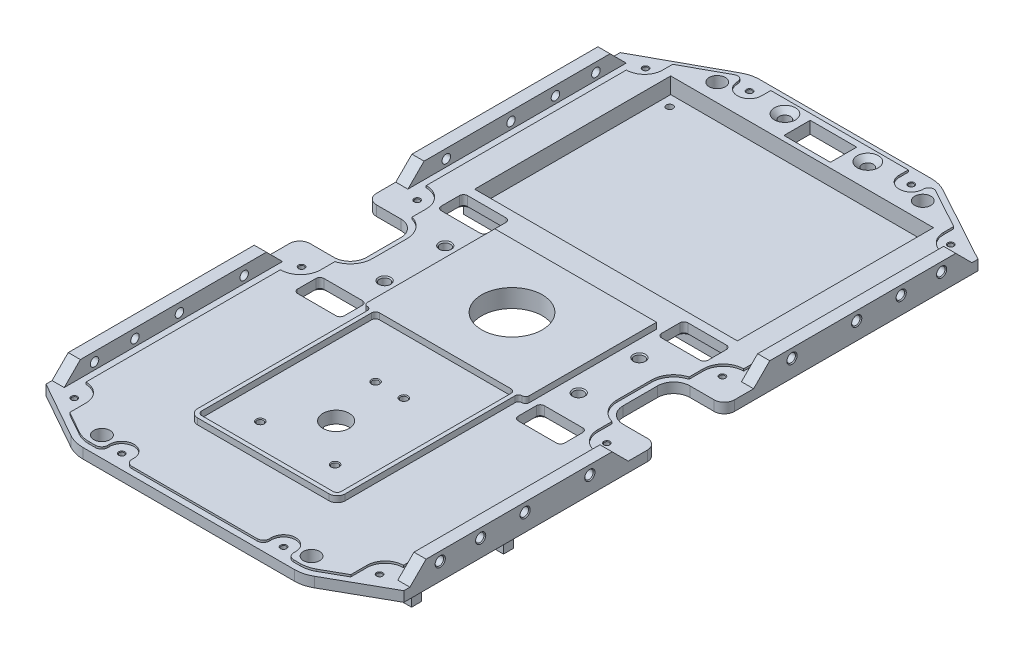
from build123d import *
from build123d.topology import SkipClean

# Parameters (mm, degrees)
BOSS_EXTRUDE1_START                                 = -5
BOSS_EXTRUDE1_OUTLINE_R                             = 6.5
BOSS_EXTRUDE1_OUTLINE_W                             = 23
BOSS_EXTRUDE1_OUTLINE_H                             = 13
BOSS_EXTRUDE1_DEPTH                                 = 5
BOSS_EXTRUDE5_OUTLINE_R                             = 6.5
BOSS_EXTRUDE5_OUTLINE_W                             = 23
BOSS_EXTRUDE5_OUTLINE_H                             = 13
BOSS_EXTRUDE5_DEPTH                                 = 1
BOSS_EXTRUDE7_START                                 = 1
BOSS_EXTRUDE7_DEPTH                                 = 3
BOSS_EXTRUDE6_START                                 = -6
SKETCH45_W                                          = 136
SKETCH45_H                                          = 102
SKETCH45_W_2                                        = 130
SKETCH45_H_2                                        = 97
BOSS_EXTRUDE6_DEPTH                                 = 5
SKETCH45_4_W                                        = 130
SKETCH45_4_H                                        = 97
CUT_EXTRUDE2_DEPTH                                  = 8
M4_TAPPED_HOLE2_D                                   = 3.3
M4_TAPPED_HOLE2_CSINK_D                             = 4.05
M4_TAPPED_HOLE2_CSINK_ANGLE                         = 90
SKETCH19_W                                          = 5
SKETCH19_H                                          = 5
BOSS_EXTRUDE4_DEPTH                                 = 87.5
BOSS_EXTRUDE2_DEPTH                                 = 6
CUT_EXTRUDE1_DEPTH                                  = 188.502666648
CUT_EXTRUDE1_DEPTH_BACK                             = 188.502666648
SKETCH20_R                                          = 6.5
MIRROR2_COPY_1_DEPTH                                = 6
M3_TAPPED_HOLE1_D                                   = 2.5
M3_TAPPED_HOLE1_CSINK_D                             = 3.05
M3_TAPPED_HOLE1_CSINK_ANGLE                         = 90
M4_TAPPED_HOLE1_D                                   = 3.3
M4_TAPPED_HOLE1_CSINK_D                             = 4.05
M4_TAPPED_HOLE1_CSINK_ANGLE                         = 90
M5_TAPPED_HOLE1_D                                   = 4.2
M5_TAPPED_HOLE1_DEPTH                               = 6
M5_TAPPED_HOLE1_CSINK_D                             = 5.05
M5_TAPPED_HOLE1_CSINK_ANGLE                         = 90
CSK_FOR_M5_COUNTERSUNK_FLAT_HEAD_SCREW1_D           = 5.5
CSK_FOR_M5_COUNTERSUNK_FLAT_HEAD_SCREW1_CSINK_D     = 10.4
CSK_FOR_M5_COUNTERSUNK_FLAT_HEAD_SCREW1_CSINK_ANGLE = 90
SKETCH60_R                                          = 4
CUT_EXTRUDE3_DEPTH                                  = 188.558657491
CUT_EXTRUDE4_DEPTH                                  = 188.686573841
CHAMFER1_SIZE                                       = 1.3
SKETCH66_R                                          = 15
CUT_EXTRUDE5_DEPTH                                  = 188.686573841


# Read off the part's stored shape, not the designer's step: Boss-Extrude1, Boss-Extrude5, Boss-Extrude7, M6 Tapped Hole1
with BuildPart() as part:
    # Boss-Extrude1 outline → Boss-Extrude1 (new body)
    with BuildSketch(Plane(origin=(0, 0, 0), x_dir=(1, 0, 0), z_dir=(0, 1, 0)).offset(BOSS_EXTRUDE1_START)):
        with BuildLine():
            Line((-52.308782665, -160), (52.308782665, -160))
            ThreePointArc((52.308782665, -160), (56.363203863, -159.477779839), (60.1529625, -157.945208594))
            Line((60.1529625, -157.945208594), (88.5, -142))
            Line((88.5, -142), (88.5, -21.5))
            ThreePointArc((88.5, -21.5), (87.035533906, -17.964466094), (83.5, -16.5))
            Line((83.5, -16.5), (71.5, -16.5))
            ThreePointArc((71.5, -16.5), (65.843145751, -14.156854249), (63.5, -8.5))
            Line((63.5, -8.5), (63.5, 8.5))
            ThreePointArc((63.5, 8.5), (65.843145751, 14.156854249), (71.5, 16.5))
            Line((71.5, 16.5), (83.5, 16.5))
            ThreePointArc((83.5, 16.5), (87.035533906, 17.964466094), (88.5, 21.5))
            Line((88.5, 21.5), (88.5, 142))
            Line((88.5, 142), (50.090926435, 163.033540285))
            ThreePointArc((50.090926435, 163.033540285), (46.372210373, 164.50059103), (42.405892469, 165))
            Line((42.405892469, 165), (-42.405892469, 165))
            ThreePointArc((-42.405892469, 165), (-46.372210373, 164.50059103), (-50.090926435, 163.033540285))
            Line((-50.090926435, 163.033540285), (-88.5, 142))
            Line((-88.5, 142), (-88.5, 21.5))
            ThreePointArc((-88.5, 21.5), (-87.035533906, 17.964466094), (-83.5, 16.5))
            Line((-83.5, 16.5), (-71.5, 16.5))
            ThreePointArc((-71.5, 16.5), (-65.843145751, 14.156854249), (-63.5, 8.5))
            Line((-63.5, 8.5), (-63.5, -8.5))
            ThreePointArc((-63.5, -8.5), (-65.843145751, -14.156854249), (-71.5, -16.5))
            Line((-71.5, -16.5), (-83.5, -16.5))
            ThreePointArc((-83.5, -16.5), (-87.035533906, -17.964466094), (-88.5, -21.5))
            Line((-88.5, -21.5), (-88.5, -142))
            Line((-88.5, -142), (-60.1529625, -157.945208594))
            ThreePointArc((-60.1529625, -157.945208594), (-56.363203863, -159.477779839), (-52.308782665, -160))
        make_face()
        with Locations((0, -87)):
            Circle(BOSS_EXTRUDE1_OUTLINE_R, mode=Mode.SUBTRACT)
        with Locations((0, 152.5)):
            Rectangle(BOSS_EXTRUDE1_OUTLINE_W, BOSS_EXTRUDE1_OUTLINE_H, mode=Mode.SUBTRACT)
    extrude(amount=BOSS_EXTRUDE1_DEPTH)

    # Boss-Extrude5 outline → Boss-Extrude5 (add)
    with BuildSketch(Plane(origin=(0, 0, 0), x_dir=(1, 0, 0), z_dir=(0, 1, 0))):
        with BuildLine():
            ThreePointArc((46, -154), (46.878679656, -156.121320344), (49, -157))
            Line((49, -157), (52.308782665, -157))
            ThreePointArc((52.308782665, -157), (55.602999888, -156.575696119), (58.682178781, -155.330481983))
            Line((58.682178781, -155.330481983), (69.5, -149.245457547))
            Line((69.5, -149.245457547), (69.5, -141.245457547))
            ThreePointArc((69.5, -141.245457547), (72.136038969, -134.881496516), (78.5, -132.245457547))
            Line((78.5, -132.245457547), (78.5, -36.083005244))
            ThreePointArc((78.5, -36.083005244), (71.428932188, -33.154073056), (68.5, -26.083005244))
            Line((68.5, -26.083005244), (68.5, -19.083005244))
            ThreePointArc((68.5, -19.083005244), (62.725035613, -15.133249581), (60.5, -8.5))
            Line((60.5, -8.5), (60.5, 8.5))
            ThreePointArc((60.5, 8.5), (62.725035613, 15.133249581), (68.5, 19.083005244))
            Line((68.5, 19.083005244), (68.5, 26.083005244))
            ThreePointArc((68.5, 26.083005244), (71.428932188, 33.154073056), (78.5, 36.083005244))
            Line((78.5, 36.083005244), (78.5, 135.055813364))
            ThreePointArc((78.5, 135.055813364), (72.136038969, 137.691852333), (69.5, 144.055813364))
            Line((69.5, 144.055813364), (69.5, 148.984384792))
            Line((69.5, 148.984384792), (49.699719909, 159.827395318))
            ThreePointArc((49.699719909, 159.827395318), (47.207567351, 159.775302647), (45.999247072, 157.59505034))
            ThreePointArc((45.999247072, 157.59505034), (40.047526661, 151.500188235), (34, 157.5))
            Line((34, 157.5), (34, 162))
            Line((34, 162), (-34, 162))
            Line((-34, 162), (-34, 157.5))
            ThreePointArc((-34, 157.5), (-40.047526661, 151.500188235), (-45.999247072, 157.59505034))
            ThreePointArc((-45.999247072, 157.59505034), (-47.207567351, 159.775302647), (-49.699719909, 159.827395318))
            Line((-49.699719909, 159.827395318), (-69.5, 148.984384792))
            Line((-69.5, 148.984384792), (-69.5, 144.055813364))
            ThreePointArc((-69.5, 144.055813364), (-72.136038969, 137.691852333), (-78.5, 135.055813364))
            Line((-78.5, 135.055813364), (-78.5, 36.083005244))
            ThreePointArc((-78.5, 36.083005244), (-71.428932188, 33.154073056), (-68.5, 26.083005244))
            Line((-68.5, 26.083005244), (-68.5, 19.083005244))
            ThreePointArc((-68.5, 19.083005244), (-62.725035613, 15.133249581), (-60.5, 8.5))
            Line((-60.5, 8.5), (-60.5, -8.5))
            ThreePointArc((-60.5, -8.5), (-62.725035613, -15.133249581), (-68.5, -19.083005244))
            Line((-68.5, -19.083005244), (-68.5, -26.083005244))
            ThreePointArc((-68.5, -26.083005244), (-71.428932188, -33.154073056), (-78.5, -36.083005244))
            Line((-78.5, -36.083005244), (-78.5, -132.245457547))
            ThreePointArc((-78.5, -132.245457547), (-72.136038969, -134.881496516), (-69.5, -141.245457547))
            Line((-69.5, -141.245457547), (-69.5, -149.245457547))
            Line((-69.5, -149.245457547), (-58.682178781, -155.330481983))
            ThreePointArc((-58.682178781, -155.330481983), (-55.602999888, -156.575696119), (-52.308782665, -157))
            Line((-52.308782665, -157), (-49, -157))
            ThreePointArc((-49, -157), (-46.878679656, -156.121320344), (-46, -154))
            Line((-46, -154), (-46, -153))
            ThreePointArc((-46, -153), (-40, -147), (-34, -153))
            Line((-34, -153), (-34, -154))
            ThreePointArc((-34, -154), (-33.121320344, -156.121320344), (-31, -157))
            Line((-31, -157), (31, -157))
            ThreePointArc((31, -157), (33.121320344, -156.121320344), (34, -154))
            Line((34, -154), (34, -153))
            ThreePointArc((34, -153), (40, -147), (46, -153))
            Line((46, -153), (46, -154))
        make_face()
        with Locations((0, -87)):
            Circle(BOSS_EXTRUDE5_OUTLINE_R, mode=Mode.SUBTRACT)
        with Locations((0, 152.5)):
            Rectangle(BOSS_EXTRUDE5_OUTLINE_W, BOSS_EXTRUDE5_OUTLINE_H, mode=Mode.SUBTRACT)
    extrude(amount=BOSS_EXTRUDE5_DEPTH)

    # Boss-Extrude7 outline → Boss-Extrude7 (add)
    with BuildSketch(Plane(origin=(0, 0, 0), x_dir=(1, 0, 0), z_dir=(0, 1, 0)).offset(BOSS_EXTRUDE7_START)):
        with BuildLine():
            Line((36.5, -119), (36.5, -35))
            ThreePointArc((36.5, -35), (37.012563133, -33.762563133), (38.25, -33.25))
            ThreePointArc((38.25, -33.25), (39.487436867, -32.737436867), (40, -31.5))
            Line((40, -31.5), (40, 31.5))
            Line((40, 31.5), (-40, 31.5))
            Line((-40, 31.5), (-40, -31.5))
            ThreePointArc((-40, -31.5), (-39.487436867, -32.737436867), (-38.25, -33.25))
            ThreePointArc((-38.25, -33.25), (-37.012563133, -33.762563133), (-36.5, -35))
            Line((-36.5, -35), (-36.5, -119))
            ThreePointArc((-36.5, -119), (-35.328427125, -121.828427125), (-32.5, -123))
            Line((-32.5, -123), (32.5, -123))
            ThreePointArc((32.5, -123), (35.328427125, -121.828427125), (36.5, -119))
        make_face()
        with BuildLine():
            Line((-34.5, -119), (-34.5, -35))
            ThreePointArc((-34.5, -35), (-33.914213562, -33.585786438), (-32.5, -33))
            Line((-32.5, -33), (32.5, -33))
            ThreePointArc((32.5, -33), (33.914213562, -33.585786438), (34.5, -35))
            Line((34.5, -35), (34.5, -119))
            ThreePointArc((34.5, -119), (33.914213562, -120.414213562), (32.5, -121))
            Line((32.5, -121), (-32.5, -121))
            ThreePointArc((-32.5, -121), (-33.914213562, -120.414213562), (-34.5, -119))
        make_face(mode=Mode.SUBTRACT)
    extrude(amount=BOSS_EXTRUDE7_DEPTH)

    # Sketch45 → Boss-Extrude6 (add)
    # profile 1 of 2: a face of its own
    with BuildSketch(Plane(origin=(0, 1, 0), x_dir=(1, 0, 0), z_dir=(0, 1, 0)).offset(BOSS_EXTRUDE6_START)):
        with Locations((0, 95)):
            Rectangle(SKETCH45_W, SKETCH45_H)
        with Locations((0, 95)):
            Rectangle(SKETCH45_W_2, SKETCH45_H_2, mode=Mode.SUBTRACT)
    # profile 2 of 2: a face of its own
    with BuildSketch(Plane(origin=(0, 1, 0), x_dir=(1, 0, 0), z_dir=(0, 1, 0)).offset(BOSS_EXTRUDE6_START)):
        with Locations((0, 95)):
            Rectangle(SKETCH45_W_2, SKETCH45_H_2)
    extrude(amount=-BOSS_EXTRUDE6_DEPTH)

    # Sketch45<4> → Cut-Extrude2 (cut)
    with BuildSketch(Plane(origin=(0, 1, 0), x_dir=(1, 0, 0), z_dir=(0, 1, 0))):
        with Locations((0, 95)):
            Rectangle(SKETCH45_4_W, SKETCH45_4_H)
    extrude(amount=-CUT_EXTRUDE2_DEPTH, mode=Mode.SUBTRACT)

    # M4 Tapped Hole2 (through all)
    with Locations(Plane(origin=(0, 1, 0), x_dir=(1, 0, 0), z_dir=(0, 1, 0))):
        with Locations((-60, 138), (60, 138), (60, 52), (-60, 52)):
            CounterSinkHole(M4_TAPPED_HOLE2_D / 2, M4_TAPPED_HOLE2_CSINK_D / 2, counter_sink_angle=M4_TAPPED_HOLE2_CSINK_ANGLE)

    # Sketch19 → Boss-Extrude4 (add, symmetric)
    with BuildSketch(Plane(origin=(0, 0, 0), x_dir=(0, 0, -1), z_dir=(1, 0, 0))):
        with Locations((-134.7, -7.5)):
            Rectangle(SKETCH19_W, SKETCH19_H)
        with Locations((-89.2, -7.5)):
            Rectangle(SKETCH19_W, SKETCH19_H)
    extrude(amount=BOSS_EXTRUDE4_DEPTH, both=True)

    # Sketch2 → Boss-Extrude2 (add)
    with BuildSketch(Plane.ZY.offset(88.5)):
        Polygon((-139, 0), (-131, 8), (-39, 8), (-31, 0), align=None)
    boss_extrude2 = extrude(amount=-BOSS_EXTRUDE2_DEPTH)

    # Sketch20 → Cut-Extrude1 (cut, two sides: drawn at the far end of the back side and taken through both)
    with SkipClean():  # the faces are left unmerged after this step: merging them gives an invalid solid
        with BuildSketch(Plane(origin=(0, 0, 0), x_dir=(1, 0, 0), z_dir=(0, 1, 0)).offset(-CUT_EXTRUDE1_DEPTH_BACK)):
            with Locations(Location((0, -87, 0), (0, 0, 270))):
                Circle(SKETCH20_R)
        extrude(amount=CUT_EXTRUDE1_DEPTH + CUT_EXTRUDE1_DEPTH_BACK, mode=Mode.SUBTRACT)

    # Mirror1: Boss-Extrude2 across plane
    with SkipClean():  # the faces are left unmerged after this step: merging them gives an invalid solid
        add(boss_extrude2.mirror(Plane(origin=(0, 0, 0), x_dir=(0, 0, 1), z_dir=(1, 0, 0))))

    # Mirror2: Boss-Extrude2 across plane
    with SkipClean():  # the faces are left unmerged after this step: merging them gives an invalid solid
        add(boss_extrude2.mirror(Plane.XY))

    # Mirror2 copy 1 sketch → Mirror2 copy 1 (add)
    with SkipClean():  # the faces are left unmerged after this step: merging them gives an invalid solid
        with BuildSketch(Plane(origin=(88.5, 0, 0), x_dir=(0, 0, -1), z_dir=(1, 0, 0))):
            Polygon((-139, 0), (-131, 8), (-39, 8), (-31, 0), align=None)
        extrude(amount=-MIRROR2_COPY_1_DEPTH)

    # M6 Tapped Hole1 outline → M6 Tapped Hole1 (revolve, cut)
    with SkipClean():  # the faces are left unmerged after this step: merging them gives an invalid solid
        with BuildSketch(Plane(origin=(48, 0, 15), x_dir=(1, 0, 0), z_dir=(0, 0, 1))):
            Polygon((0, -5), (2.5, -5), (2.5, 0.475), (3.025, 1), (0, 1), align=None)
        revolve(axis=Axis((48, 0, 15), (0, 1, 0)), mode=Mode.SUBTRACT)

    # M6 Tapped Hole1 2 outline → M6 Tapped Hole1 2 (revolve, cut)
    with SkipClean():  # the faces are left unmerged after this step: merging them gives an invalid solid
        with BuildSketch(Plane(origin=(-48, 0, -15), x_dir=(1, 0, 0), z_dir=(0, 0, 1))):
            Polygon((0, -5), (2.5, -5), (2.5, 0.475), (3.025, 1), (0, 1), align=None)
        revolve(axis=Axis((-48, 0, -15), (0, 1, 0)), mode=Mode.SUBTRACT)

    # M6 Tapped Hole1 3 outline → M6 Tapped Hole1 3 (revolve, cut)
    with SkipClean():  # the faces are left unmerged after this step: merging them gives an invalid solid
        with BuildSketch(Plane(origin=(-48, 0, 15), x_dir=(1, 0, 0), z_dir=(0, 0, 1))):
            Polygon((0, -5), (2.5, -5), (2.5, 0.475), (3.025, 1), (0, 1), align=None)
        revolve(axis=Axis((-48, 0, 15), (0, 1, 0)), mode=Mode.SUBTRACT)

    # M6 Tapped Hole1 4 outline → M6 Tapped Hole1 4 (revolve, cut)
    with SkipClean():  # the faces are left unmerged after this step: merging them gives an invalid solid
        with BuildSketch(Plane(origin=(48, 0, -15), x_dir=(1, 0, 0), z_dir=(0, 0, 1))):
            Polygon((0, -5), (2.5, -5), (2.5, 0.475), (3.025, 1), (0, 1), align=None)
        revolve(axis=Axis((48, 0, -15), (0, 1, 0)), mode=Mode.SUBTRACT)

    # M3 Tapped Hole1 (through all)
    with Locations(Plane(origin=(0, 0, 0), x_dir=(1, 0, 0), z_dir=(0, 1, 0))):
        with Locations((-75.5, 141.555813364), (-40, 157.5), (-75.5, 28.583005244), (-75.5, -28.583005244), (-75.5, -141), (-40, -153), (40, -153), (75.5, -141), (75.5, -28.583005244), (75.5, 28.583005244), (40, 157.5), (75.5, 141.555813364)):
            CounterSinkHole(M3_TAPPED_HOLE1_D / 2, M3_TAPPED_HOLE1_CSINK_D / 2, counter_sink_angle=M3_TAPPED_HOLE1_CSINK_ANGLE)

    # M4 Tapped Hole1 (through all)
    with Locations(Plane(origin=(0, 1, 0), x_dir=(1, 0, 0), z_dir=(0, 1, 0))):
        with Locations((-7, -60.5), (7, -60.5), (18.5, -106), (-18.5, -106)):
            CounterSinkHole(M4_TAPPED_HOLE1_D / 2, M4_TAPPED_HOLE1_CSINK_D / 2, counter_sink_angle=M4_TAPPED_HOLE1_CSINK_ANGLE)

    # M5 Tapped Hole1
    with Locations(Plane.ZY.offset(88.5)):
        with Locations((-124, 3.5), (-104, 3.5), (-82, 3.5), (-50, 3.5), (50, 3.5), (82, 3.5), (104, 3.5), (124, 3.5)):
            m5_tapped_hole1 = CounterSinkHole(M5_TAPPED_HOLE1_D / 2, M5_TAPPED_HOLE1_CSINK_D / 2, depth=M5_TAPPED_HOLE1_DEPTH, counter_sink_angle=M5_TAPPED_HOLE1_CSINK_ANGLE)

    # Mirror3: M5 Tapped Hole1 across plane
    with SkipClean():  # the faces are left unmerged after this step: merging them gives an invalid solid
        add(m5_tapped_hole1.mirror(Plane(origin=(0, 0, 0), x_dir=(0, 0, 1), z_dir=(1, 0, 0))), mode=Mode.SUBTRACT)

    # CSK for M5 Countersunk Flat Head Screw1 (through all)
    with Locations(Plane(origin=(0, 1, 0), x_dir=(1, 0, 0), z_dir=(0, 1, 0))):
        with Locations((-20.5, 155.5), (20.5, 155.5)):
            CounterSinkHole(CSK_FOR_M5_COUNTERSUNK_FLAT_HEAD_SCREW1_D / 2, CSK_FOR_M5_COUNTERSUNK_FLAT_HEAD_SCREW1_CSINK_D / 2, counter_sink_angle=CSK_FOR_M5_COUNTERSUNK_FLAT_HEAD_SCREW1_CSINK_ANGLE)

    # Sketch60 → Cut-Extrude3 (cut, through all)
    with SkipClean():  # the faces are left unmerged after this step: merging them gives an invalid solid
        with BuildSketch(Plane(origin=(0, 1, 0), x_dir=(1, 0, 0), z_dir=(0, 1, 0))):
            with Locations(Location((-50.84356739, 152.360248425, 0), (0, 0, 270))):
                Circle(SKETCH60_R)
            with Locations(Location((50.84356739, 152.360248425, 0), (0, 0, 270))):
                Circle(SKETCH60_R)
            with Locations(Location((-51.832159566, -151, 0), (0, 0, 270))):
                Circle(SKETCH60_R)
            with Locations(Location((51.832159566, -151, 0), (0, 0, 270))):
                Circle(SKETCH60_R)
        extrude(amount=-CUT_EXTRUDE3_DEPTH, mode=Mode.SUBTRACT)

    # Sketch62 → Cut-Extrude4 (cut, through all)
    with SkipClean():  # the faces are left unmerged after this step: merging them gives an invalid solid
        with BuildSketch(Plane.XZ.offset(5)):
            with BuildLine():
                Line((-64, -29), (-45, -29))
                ThreePointArc((-45, -29), (-43.585786438, -29.585786438), (-43, -31))
                Line((-43, -31), (-43, -40))
                ThreePointArc((-43, -40), (-43.585786438, -41.414213562), (-45, -42))
                Line((-45, -42), (-64, -42))
                ThreePointArc((-64, -42), (-65.414213562, -41.414213562), (-66, -40))
                Line((-66, -40), (-66, -31))
                ThreePointArc((-66, -31), (-65.414213562, -29.585786438), (-64, -29))
            make_face()
            with BuildLine():
                Line((64, -42), (45, -42))
                ThreePointArc((45, -42), (43.585786438, -41.414213562), (43, -40))
                Line((43, -40), (43, -31))
                ThreePointArc((43, -31), (43.585786438, -29.585786438), (45, -29))
                Line((45, -29), (64, -29))
                ThreePointArc((64, -29), (65.414213562, -29.585786438), (66, -31))
                Line((66, -31), (66, -40))
                ThreePointArc((66, -40), (65.414213562, -41.414213562), (64, -42))
            make_face()
            with BuildLine():
                Line((64, 42), (45, 42))
                ThreePointArc((45, 42), (43.585786438, 41.414213562), (43, 40))
                Line((43, 40), (43, 31))
                ThreePointArc((43, 31), (43.585786438, 29.585786438), (45, 29))
                Line((45, 29), (64, 29))
                ThreePointArc((64, 29), (65.414213562, 29.585786438), (66, 31))
                Line((66, 31), (66, 40))
                ThreePointArc((66, 40), (65.414213562, 41.414213562), (64, 42))
            make_face()
            with BuildLine():
                Line((-64, 42), (-45, 42))
                ThreePointArc((-45, 42), (-43.585786438, 41.414213562), (-43, 40))
                Line((-43, 40), (-43, 31))
                ThreePointArc((-43, 31), (-43.585786438, 29.585786438), (-45, 29))
                Line((-45, 29), (-64, 29))
                ThreePointArc((-64, 29), (-65.414213562, 29.585786438), (-66, 31))
                Line((-66, 31), (-66, 40))
                ThreePointArc((-66, 40), (-65.414213562, 41.414213562), (-64, 42))
            make_face()
        extrude(amount=-CUT_EXTRUDE4_DEPTH, mode=Mode.SUBTRACT)

    # Chamfer1
    chamfer1_edges = [part.edges().sort_by_distance(p)[0] for p in [
        (-43.585786438, -5, 41.414213562),
        (-54.5, -5, 42),
        (-65.414213562, -5, 41.414213562),
        (-66, -5, 35.5),
        (-65.414213562, -5, 29.585786438),
        (-54.5, -5, 29),
        (-43.585786438, -5, 29.585786438),
        (-43, -5, 35.5),
        (65.414213562, -5, 41.414213562),
        (54.5, -5, 42),
        (43.585786438, -5, 41.414213562),
        (43, -5, 35.5),
        (43.585786438, -5, 29.585786438),
        (54.5, -5, 29),
        (65.414213562, -5, 29.585786438),
        (66, -5, 35.5),
        (43.585786438, -5, -41.414213562),
        (54.5, -5, -42),
        (65.414213562, -5, -41.414213562),
        (66, -5, -35.5),
        (65.414213562, -5, -29.585786438),
        (54.5, -5, -29),
        (43.585786438, -5, -29.585786438),
        (43, -5, -35.5),
        (-65.414213562, -5, -41.414213562),
        (-54.5, -5, -42),
        (-43.585786438, -5, -41.414213562),
        (-43, -5, -35.5),
        (-43.585786438, -5, -29.585786438),
        (-54.5, -5, -29),
        (-65.414213562, -5, -29.585786438),
        (-66, -5, -35.5),
    ]]
    chamfer(chamfer1_edges, length=CHAMFER1_SIZE)

    # Sketch66 → Cut-Extrude5 (cut, through all)
    with SkipClean():  # the faces are left unmerged after this step: merging them gives an invalid solid
        with BuildSketch(Plane.XZ.offset(5)):
            with Locations(Location((0, 0, 0), (0, 0, 270))):
                Circle(SKETCH66_R)
        extrude(amount=-CUT_EXTRUDE5_DEPTH, mode=Mode.SUBTRACT)


solid = part.part
